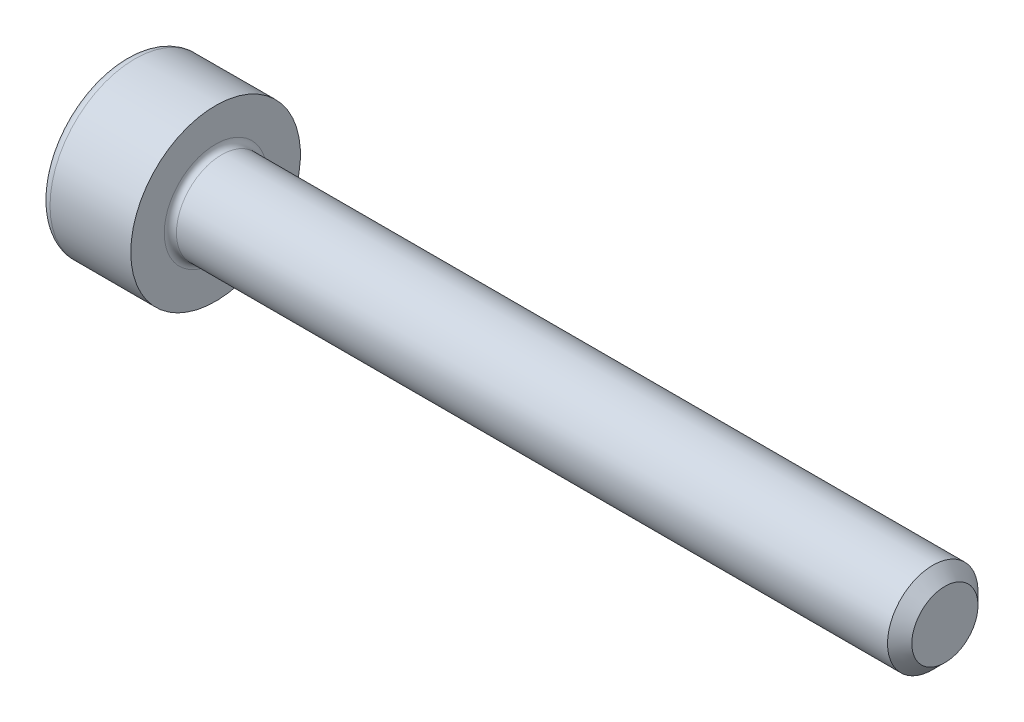
from build123d import *

# Parameters (mm, degrees)
FILLET1_R      = 0.1
FILLET2_R      = 0.16
CHAMFER1_SIZE  = 0.2
EXTRUDE1_DEPTH = 0.7


with BuildPart() as part:
    # Sketch1 → Revolve1 (revolve)
    with BuildSketch(Plane.XY):
        Polygon((0, 1.395688245), (0, 0), (13.488734128, 0), (13.488734128, 0.744367064), (1.488734128, 0.744367064), (1.488734128, 1.395688245), align=None)
    revolve(axis=Axis((0, 0, 0), (1, 0, 0)))

    # Fillet1
    fillet1_edges = [part.edges().sort_by_distance(p)[0] for p in [
        (1.488734128, -0.744367064, 0),
    ]]
    fillet(fillet1_edges, radius=FILLET1_R)

    # Fillet2
    fillet2_edges = [part.edges().sort_by_distance(p)[0] for p in [
        (0, -1.395688245, 0),
    ]]
    fillet(fillet2_edges, radius=FILLET2_R)

    # Chamfer1
    chamfer1_edges = [part.edges().sort_by_distance(p)[0] for p in [
        (13.488734128, -0.744367064, 0),
    ]]
    chamfer(chamfer1_edges, length=CHAMFER1_SIZE)

    # Sketch2 → Extrude1 (cut)
    with BuildSketch(Plane.ZY):
        Polygon((0, 0.877572409), (-0.76, 0.438786205), (-0.76, -0.438786205), (0, -0.877572409), (0.76, -0.438786205), (0.76, 0.438786205), align=None)
    extrude(amount=-EXTRUDE1_DEPTH, mode=Mode.SUBTRACT)


solid = part.part
